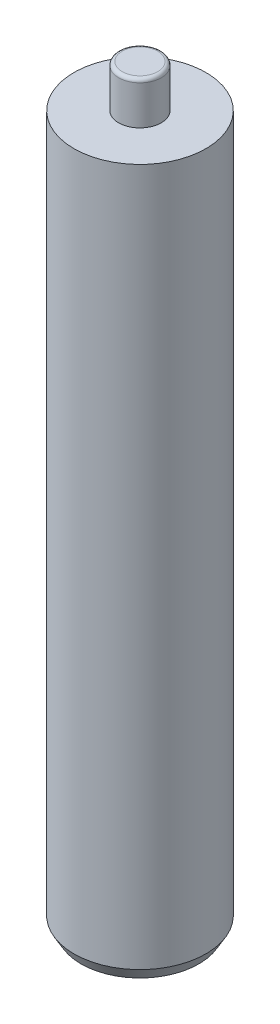
from build123d import *

# Parameters (mm, degrees)
SKETCH2_R           = 9.3
BOSS_EXTRUDE1_DEPTH = 100
SKETCH3_R           = 3
BOSS_EXTRUDE2_DEPTH = 6
CHAMFER1_SIZE       = 1
CHAMFER1_SIZE2      = 1.732050808
FILLET1_R           = 0.5


with BuildPart() as part:
    # Sketch2 → Boss-Extrude1 (new body)
    with BuildSketch(Plane(origin=(0, 0, 0), x_dir=(1, 0, 0), z_dir=(0, 1, 0))):
        Circle(SKETCH2_R)
    extrude(amount=BOSS_EXTRUDE1_DEPTH)

    # Sketch3 → Boss-Extrude2 (add)
    with BuildSketch(Plane(origin=(0, 100, 0), x_dir=(1, 0, 0), z_dir=(0, 1, 0))):
        Circle(SKETCH3_R)
    extrude(amount=BOSS_EXTRUDE2_DEPTH)

    # Chamfer1
    chamfer1_edges = [part.edges().sort_by_distance(p)[0] for p in [
        (-9.3, 0, 0),
    ]]
    chamfer1_side = [part.faces().sort_by_distance(p)[0] for p in [
        (0, 0, 0),
    ]]
    chamfer(chamfer1_edges, length=CHAMFER1_SIZE, length2=CHAMFER1_SIZE2, reference=chamfer1_side[0])

    # Fillet1
    fillet1_edges = [part.edges().sort_by_distance(p)[0] for p in [
        (-3, 106, 0),
    ]]
    fillet(fillet1_edges, radius=FILLET1_R)


solid = part.part
